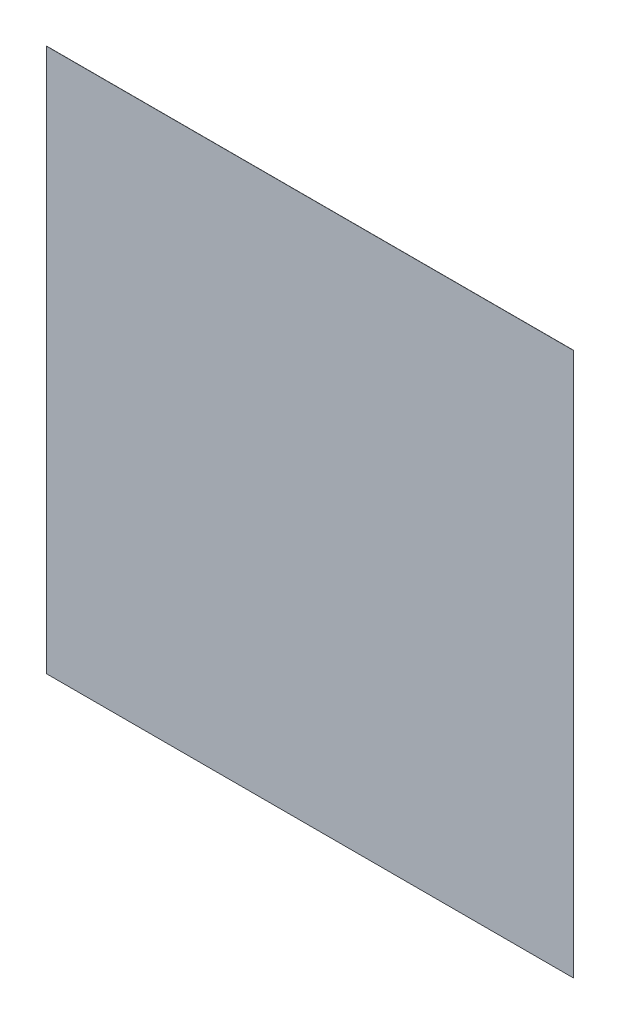
from build123d import *

# Parameters (mm, degrees)
SKETCH_1_W      = 320
SKETCH_1_H      = 330
EXTRUDE_1_DEPTH = 0.1


with BuildPart() as part:
    # 草图1 → 凸台-拉伸1 (new body)
    with BuildSketch(Plane.XY):
        Rectangle(SKETCH_1_W, SKETCH_1_H)
    extrude(amount=EXTRUDE_1_DEPTH)


solid = part.part
